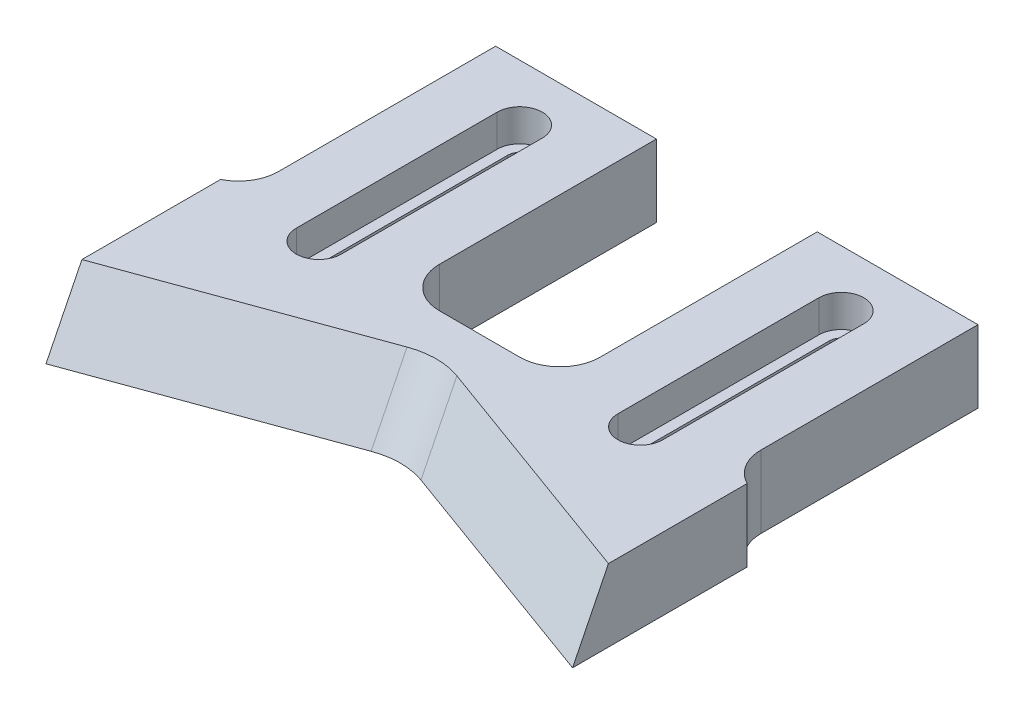
from build123d import *

# Parameters (mm, degrees)
BOSS_EXTRUDE1_DEPTH = 9
CUT_EXTRUDE2_REACH  = 95.842
SKETCH5_W           = 20
SKETCH5_H           = 32
SKETCH5_W_2         = 7.75
CUT_EXTRUDE3_DEPTH  = 10
FILLET1_R           = 5
CUT_EXTRUDE4_DEPTH  = 4
CHAMFER1_SIZE       = 9
CHAMFER1_SIZE_2     = 4.196768923
FILLET2_R           = 10
CUT_EXTRUDE5_REACH  = 95.842
SKETCH7_W           = 5
SKETCH7_H           = 33.085129134
SKETCH7_H_2         = 33.745309592


with BuildPart() as part:
    # Sketch1 → Boss-Extrude1 (new body)
    with BuildSketch(Plane(origin=(0, 0, 0), x_dir=(1, 0, 0), z_dir=(0, 1, 0))):
        Polygon((0, 0), (0, 55), (75.5, 55), (75.5, 0), (37.75, 13.739876344), align=None)
    extrude(amount=BOSS_EXTRUDE1_DEPTH)

    # Sketch4 → Cut-Extrude2 (cut, up to next)
    with BuildSketch(Plane(origin=(0, 9, 0), x_dir=(1, 0, 0), z_dir=(0, 1, 0)), mode=Mode.PRIVATE) as cut_extrude2_sk1:
        with BuildLine():
            Line((19.25, 48), (19.25, 23))
            ThreePointArc((19.25, 23), (17.75, 21.5), (16.25, 23))
            Line((16.25, 23), (16.25, 48))
            ThreePointArc((16.25, 48), (17.75, 49.5), (19.25, 48))
        make_face()
    cut_extrude2_tool1 = extrude(cut_extrude2_sk1.sketch, amount=-CUT_EXTRUDE2_REACH, mode=Mode.PRIVATE) & part.part
    # Sketch4 → Cut-Extrude2 (cut, up to next)
    with BuildSketch(Plane(origin=(0, 9, 0), x_dir=(1, 0, 0), z_dir=(0, 1, 0)), mode=Mode.PRIVATE) as cut_extrude2_sk2:
        with BuildLine():
            Line((59.25, 48), (59.25, 23))
            ThreePointArc((59.25, 23), (57.75, 21.5), (56.25, 23))
            Line((56.25, 23), (56.25, 48))
            ThreePointArc((56.25, 48), (57.75, 49.5), (59.25, 48))
        make_face()
    cut_extrude2_tool2 = extrude(cut_extrude2_sk2.sketch, amount=-CUT_EXTRUDE2_REACH, mode=Mode.PRIVATE) & part.part
    add(cut_extrude2_tool1.solids().sort_by_distance((17.75, 9, -35.5))[0], mode=Mode.SUBTRACT)
    add(cut_extrude2_tool2.solids().sort_by_distance((57.75, 9, -35.5))[0], mode=Mode.SUBTRACT)

    # Sketch5 → Cut-Extrude3 (cut)
    with BuildSketch(Plane(origin=(0, 9, 0), x_dir=(1, 0, 0), z_dir=(0, 1, 0))):
        with Locations((37.75, 39)):
            Rectangle(SKETCH5_W, SKETCH5_H)
        with Locations((71.625, 39)):
            Rectangle(SKETCH5_W_2, SKETCH5_H)
        with Locations((3.875, 39)):
            Rectangle(SKETCH5_W_2, SKETCH5_H)
    extrude(amount=-CUT_EXTRUDE3_DEPTH, mode=Mode.SUBTRACT)

    # Fillet1
    fillet1_edges = [part.edges().sort_by_distance(p)[0] for p in [
        (27.75, 4.5, -23),
        (47.75, 4.5, -23),
        (7.75, 4.5, -23),
        (67.75, 4.5, -23),
    ]]
    fillet(fillet1_edges, radius=FILLET1_R)

    # Sketch6 → Cut-Extrude4 (cut)
    with BuildSketch(Plane(origin=(0, 9, 0), x_dir=(1, 0, 0), z_dir=(0, 1, 0))):
        with BuildLine():
            Line((20.55, 48), (20.55, 23))
            ThreePointArc((20.55, 23), (17.75, 20.2), (14.95, 23))
            Line((14.95, 23), (14.95, 48))
            ThreePointArc((14.95, 48), (17.75, 50.8), (20.55, 48))
        make_face()
        with BuildLine():
            Line((60.55, 48), (60.55, 23))
            ThreePointArc((60.55, 23), (57.75, 20.2), (54.95, 23))
            Line((54.95, 23), (54.95, 48))
            ThreePointArc((54.95, 48), (57.75, 50.8), (60.55, 48))
        make_face()
    extrude(amount=-CUT_EXTRUDE4_DEPTH, mode=Mode.SUBTRACT)

    # Chamfer1
    # the kernel refuses this chamfer: 9, 4.196768923 mm, written as the material it takes off along each edge
    with BuildSketch(Plane(origin=(97.41248478, 9, 7.975492219), x_dir=(-0.005578746693930982, -0.9998669641130703, 0.015327480570432298), z_dir=(-0.939692620785907, 0, -0.3420201433256727))) as chamfer1_piece_1_section:
        Polygon((CHAMFER1_SIZE * 0.999866964113, -CHAMFER1_SIZE * 0.0163111641311), (-CHAMFER1_SIZE_2 * 0.0163111641326, -CHAMFER1_SIZE_2 * 0.999866964207), (0, 0), align=None)
    chamfer1_piece_1 = extrude(amount=86.810269397, mode=Mode.PRIVATE)
    chamfer1_piece_1 = split(chamfer1_piece_1, bisect_by=Plane(origin=(61.945555659, 5.929396418, -22.546338405), z_dir=(0.3420201433256727, 0, 0.939692620785907)), keep=Keep.TOP, mode=Mode.PRIVATE)
    add(chamfer1_piece_1, mode=Mode.SUBTRACT)
    with BuildSketch(Plane(origin=(59.66248478, 9, -21.715368562), x_dir=(0.0055787466939309265, -0.9998669641130703, 0.015327480570432147), z_dir=(-0.939692620785907, 0, 0.3420201433256727))) as chamfer1_piece_2_section:
        Polygon((CHAMFER1_SIZE * 0.999866964113, -CHAMFER1_SIZE * 0.0163111641311), (-CHAMFER1_SIZE_2 * 0.0163111641326, -CHAMFER1_SIZE_2 * 0.999866964207), (0, 0), align=None)
    chamfer1_piece_2 = extrude(amount=86.810269397, mode=Mode.PRIVATE)
    chamfer1_piece_2 = split(chamfer1_piece_2, bisect_by=Plane(origin=(13.554444341, 5.929396418, -22.546338405), z_dir=(-0.3420201433256727, 0, 0.939692620785907)), keep=Keep.TOP, mode=Mode.PRIVATE)
    add(chamfer1_piece_2, mode=Mode.SUBTRACT)
    with BuildSketch(Plane(origin=(97.41248478, 9, 7.975492219), x_dir=(-0.005578746693930982, -0.9998669641130703, 0.015327480570432298), z_dir=(-0.939692620785907, 0, -0.3420201433256727))) as chamfer1_piece_3a_section:
        Polygon((CHAMFER1_SIZE * 0.999866964113, -CHAMFER1_SIZE * 0.0163111641311), (-CHAMFER1_SIZE_2 * 0.0163111641326, -CHAMFER1_SIZE_2 * 0.999866964207), (0, 0), align=None)
    chamfer1_piece_3a = extrude(amount=86.810269397, mode=Mode.PRIVATE)
    chamfer1_piece_3a = split(chamfer1_piece_3a, bisect_by=Plane(origin=(30.782637317, 6.02174195, -11.203963716), z_dir=(-0.3420201433256727, 0, -0.939692620785907)), keep=Keep.TOP, mode=Mode.PRIVATE)
    with BuildSketch(Plane(origin=(59.66248478, 9, -21.715368562), x_dir=(0.0055787466939309265, -0.9998669641130703, 0.015327480570432147), z_dir=(-0.939692620785907, 0, 0.3420201433256727))) as chamfer1_piece_3b_section:
        Polygon((CHAMFER1_SIZE * 0.999866964113, -CHAMFER1_SIZE * 0.0163111641311), (-CHAMFER1_SIZE_2 * 0.0163111641326, -CHAMFER1_SIZE_2 * 0.999866964207), (0, 0), align=None)
    chamfer1_piece_3b = extrude(amount=86.810269397, mode=Mode.PRIVATE)
    chamfer1_piece_3b = split(chamfer1_piece_3b, bisect_by=Plane(origin=(44.717362683, 6.02174195, -11.203963716), z_dir=(0.3420201433256727, 0, -0.939692620785907)), keep=Keep.TOP, mode=Mode.PRIVATE)
    chamfer1_piece_3 = chamfer1_piece_3a & chamfer1_piece_3b
    add(chamfer1_piece_3, mode=Mode.SUBTRACT)

    # Fillet2
    fillet2_edges = [part.edges().sort_by_distance(p)[0] for p in [
        (37.75, 4.5, -15.972930446),
    ]]
    fillet(fillet2_edges, radius=FILLET2_R)

    # Sketch7 → Cut-Extrude5 (cut, up to next)
    with BuildSketch(Plane(origin=(0, 9, 0), x_dir=(1, 0, 0), z_dir=(0, 1, 0)), mode=Mode.PRIVATE) as cut_extrude5_sk1:
        with Locations((2.5, 16.542564567)):
            Rectangle(SKETCH7_W, SKETCH7_H)
    cut_extrude5_tool1 = extrude(cut_extrude5_sk1.sketch, amount=-CUT_EXTRUDE5_REACH, mode=Mode.PRIVATE) & part.part
    # Sketch7 → Cut-Extrude5 (cut, up to next)
    with BuildSketch(Plane(origin=(0, 9, 0), x_dir=(1, 0, 0), z_dir=(0, 1, 0)), mode=Mode.PRIVATE) as cut_extrude5_sk2:
        with Locations((73, 16.872654796)):
            Rectangle(SKETCH7_W, SKETCH7_H_2)
    cut_extrude5_tool2 = extrude(cut_extrude5_sk2.sketch, amount=-CUT_EXTRUDE5_REACH, mode=Mode.PRIVATE) & part.part
    add(cut_extrude5_tool1.solids().sort_by_distance((2.5, 9, -16.542565))[0], mode=Mode.SUBTRACT)
    add(cut_extrude5_tool2.solids().sort_by_distance((73, 9, -16.872655))[0], mode=Mode.SUBTRACT)


solid = part.part
